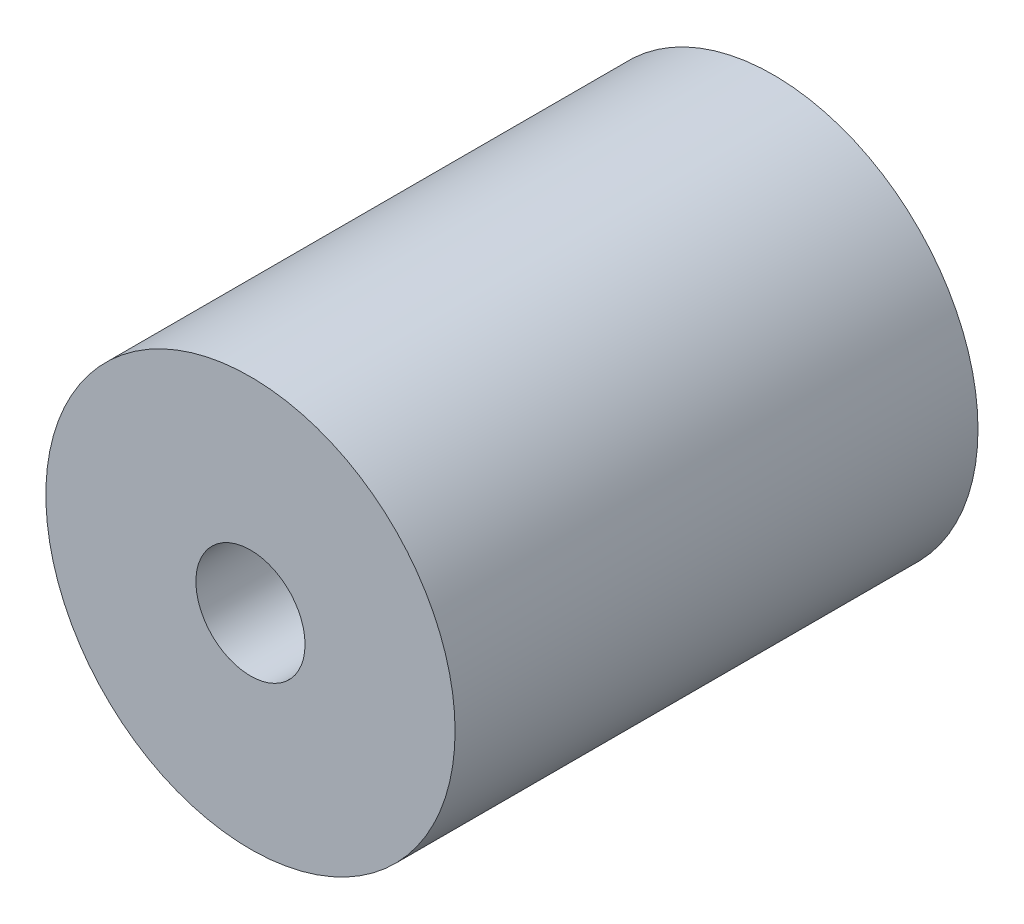
from build123d import *

# Parameters (mm, degrees)
SKETCH_1_R               = 4.5
SKETCH_1_R_2             = 1.525
EXTRUDE_1_DEPTH          = 4
CUT_EXTRUDE_2_DEPTH      = 8.516648189
PATTERN_CIRCULAR_1_COUNT = 9
SKETCH_3_R               = 4.5
EXTRUDE_2_DEPTH          = 1
SKETCH_3_3_R             = 4.5
SKETCH_3_3_R_2           = 1.2
EXTRUDE_3_DEPTH          = 7.5


with BuildPart() as part:
    # 草图1 → 凸台-拉伸1 (new body)
    with BuildSketch(Plane.XY):
        Circle(SKETCH_1_R)
        Circle(SKETCH_1_R_2, mode=Mode.SUBTRACT)
    extrude(amount=EXTRUDE_1_DEPTH)

    # 草图1<3> → 切除-拉伸2 (cut, through all)
    with BuildSketch(Plane.XY):
        with BuildLine():
            Line((1.629066618, 0.455119711), (1.468758411, 0.410333682))
            ThreePointArc((1.468758411, 0.410333682), (1.51087418, 0.207085035), (1.525, 0))
            ThreePointArc((1.525, 0), (1.51087418, -0.207085035), (1.468758411, -0.410333682))
            Line((1.468758411, -0.410333682), (1.629066618, -0.455119711))
            add(Edge.make_bspline(
                [(1.629066618, -0.455119711), (1.641483046, -0.458588545), (1.676886801, -0.465581385), (1.74601147, -0.46838824), (1.857617417, -0.457440389), (1.998539397, -0.420943181), (2.163995746, -0.351850331), (2.289812361, -0.276606271), (2.373454255, -0.216312222), (2.418244016, -0.180889134)],
                knots=[0, 0, 0, 0, 0, 0.005604068, 0.015718248, 0.029959916, 0.048733667, 0.068727063, 0.093605144, 0.093605144, 0.093605144, 0.093605144, 0.093605144], degree=4))
            ThreePointArc((2.418244016, -0.180889134), (2.423310415, -0.090507627), (2.425, 0))
            ThreePointArc((2.425, 0), (2.423310415, 0.090507627), (2.418244016, 0.180889134))
            add(Edge.make_bspline(
                [(1.629066618, 0.455119711), (1.641483046, 0.458588545), (1.676886801, 0.465581385), (1.74601147, 0.46838824), (1.857617417, 0.457440389), (1.998539397, 0.420943181), (2.163995746, 0.351850331), (2.289812361, 0.276606271), (2.373454255, 0.216312222), (2.418244016, 0.180889134)],
                knots=[0, 0, 0, 0, 0, 0.005604068, 0.015718248, 0.029959916, 0.048733667, 0.068727063, 0.093605144, 0.093605144, 0.093605144, 0.093605144, 0.093605144], degree=4))
        make_face()
    cut_extrude_2 = extrude(amount=CUT_EXTRUDE_2_DEPTH, mode=Mode.SUBTRACT)

    # 阵列(圆周)1: 切除-拉伸2 ×9 about axis
    pattern_circular_1_axis = Axis((0, 0, 4), (0, 0, 1))
    for i in range(1, PATTERN_CIRCULAR_1_COUNT):
        add(cut_extrude_2.rotate(pattern_circular_1_axis, i * 360 / PATTERN_CIRCULAR_1_COUNT), mode=Mode.SUBTRACT)

    # 草图3 → 凸台-拉伸2 (add)
    with BuildSketch(Plane.XY.offset(4)):
        Circle(SKETCH_3_R)
    extrude(amount=EXTRUDE_2_DEPTH)

    # 草图3<3> → 凸台-拉伸3 (add)
    with BuildSketch(Plane.XY.offset(4)):
        Circle(SKETCH_3_3_R)
        Circle(SKETCH_3_3_R_2, mode=Mode.SUBTRACT)
    extrude(amount=EXTRUDE_3_DEPTH)


solid = part.part
